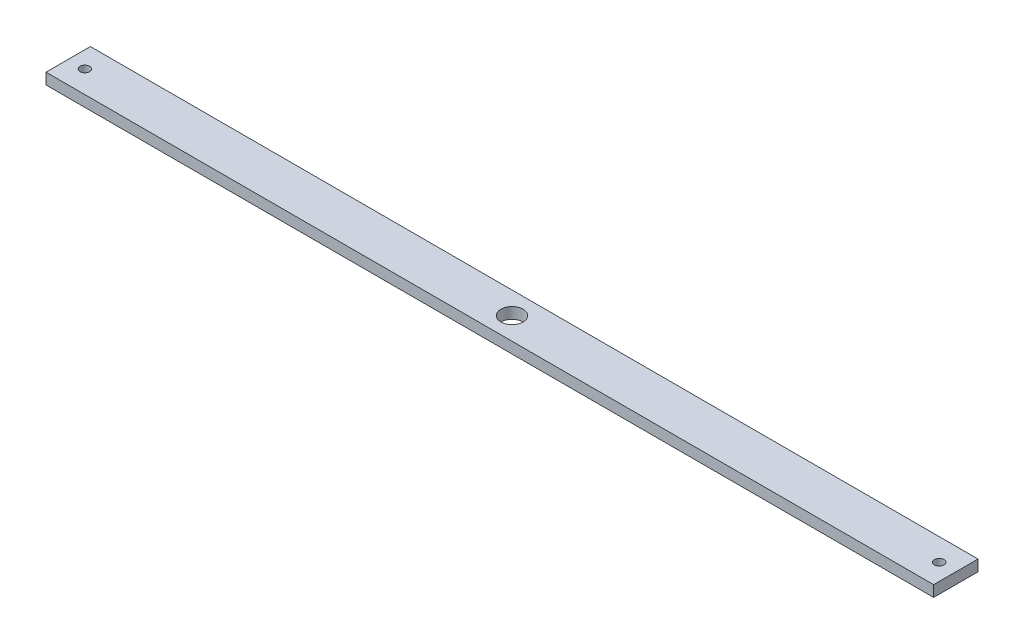
from build123d import *

# Parameters (mm, degrees)
SKETCH1_W               = 508
SKETCH1_H               = 25.4
BOSS_EXTRUDE1_DEPTH     = 6.35
F_1_4_28_TAPPED_HOLE1_D = 5.4102
SKETCH5_R               = 6.35
CUT_EXTRUDE1_DEPTH      = 255.396565425


with BuildPart() as part:
    # Sketch1 → Boss-Extrude1 (new body)
    with BuildSketch(Plane(origin=(0, 0, 0), x_dir=(1, 0, 0), z_dir=(0, 1, 0))):
        Rectangle(SKETCH1_W, SKETCH1_H)
    extrude(amount=BOSS_EXTRUDE1_DEPTH)

    # 1/4-28 Tapped Hole1 (through all)
    with Locations(Plane(origin=(0, 6.35, 0), x_dir=(1, 0, 0), z_dir=(0, 1, 0))):
        with Locations((-244.475, 0), (244.475, 0)):
            Hole(F_1_4_28_TAPPED_HOLE1_D / 2)

    # Sketch5 → Cut-Extrude1 (cut, through all)
    with BuildSketch(Plane(origin=(0, 6.35, 0), x_dir=(1, 0, 0), z_dir=(0, 1, 0))):
        Circle(SKETCH5_R)
    extrude(amount=-CUT_EXTRUDE1_DEPTH, mode=Mode.SUBTRACT)


solid = part.part
